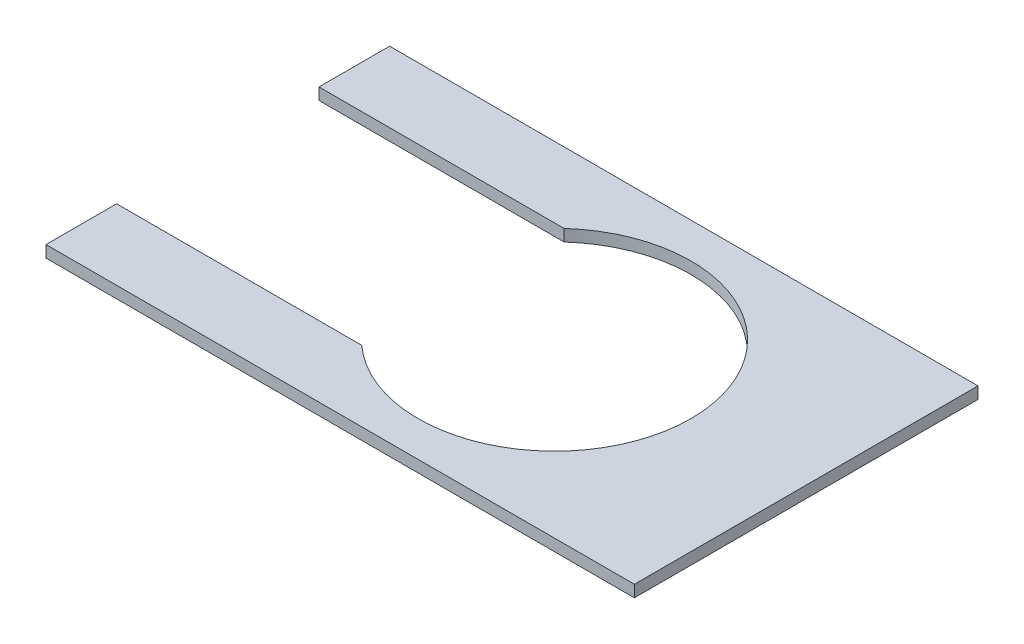
from build123d import *

# Parameters (mm, degrees)
BOSS_EXTRUDE1_DEPTH = 5


with BuildPart() as part:
    # Sketch1 → Boss-Extrude1 (new body)
    with BuildSketch(Plane(origin=(0, 0, 0), x_dir=(1, 0, 0), z_dir=(0, 1, 0))):
        with BuildLine():
            Line((-228.663769869, 10), (-118.663769869, 10))
            Line((-118.663769869, 10), (21.336230131, 10))
            Line((21.336230131, 10), (21.336230131, -106))
            Line((21.336230131, -106), (21.336230131, -136))
            Line((21.336230131, -136), (-118.663769869, -136))
            Line((-118.663769869, -136), (-228.663769869, -136))
            Line((-228.663769869, -136), (-228.663769869, -106))
            Line((-228.663769869, -106), (-124.517389937, -106))
            ThreePointArc((-124.517389937, -106), (-27.594389025, -63), (-124.517389937, -20))
            Line((-124.517389937, -20), (-228.663769869, -20))
            Line((-228.663769869, -20), (-228.663769869, 10))
        make_face()
    extrude(amount=BOSS_EXTRUDE1_DEPTH)


solid = part.part
